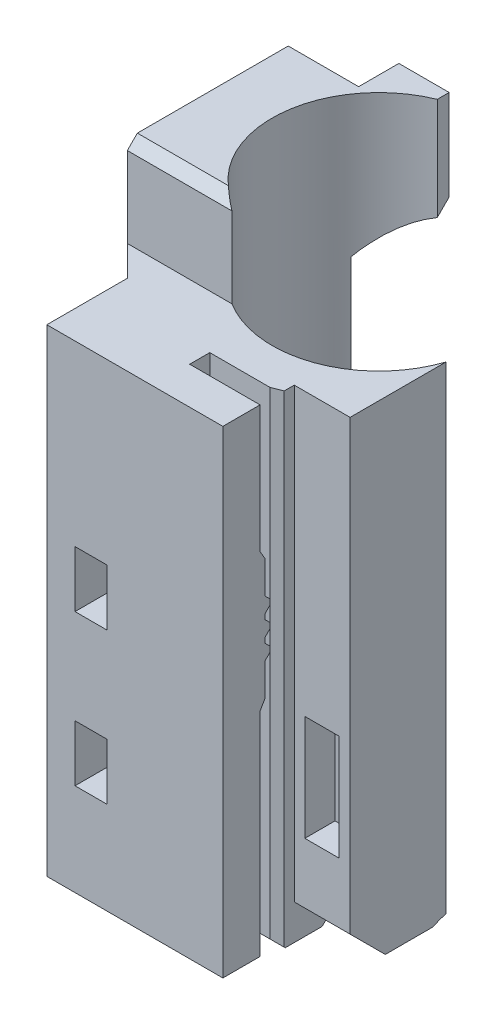
from build123d import *

# Parameters (mm, degrees)
BOSS_EXTRUDE1_DEPTH      = 37
BOSS_EXTRUDE1_DEPTH_BACK = 20
CUT_EXTRUDE5_DEPTH       = 7
CHAMFER2_SIZE            = 3.5
CHAMFER3_SIZE            = 0.5
SKETCH6_R                = 1.55
CUT_EXTRUDE6_DEPTH       = 10
CUT_EXTRUDE7_START       = -2.8
CUT_EXTRUDE7_DEPTH       = 3.2
CUT_EXTRUDE9_DEPTH       = 10
BOSS_EXTRUDE2_DEPTH      = 3
SKETCH10_W               = 7
SKETCH10_H               = 8.2
CUT_EXTRUDE10_DEPTH      = 4
SKETCH11_R               = 1.25
CUT_EXTRUDE11_DEPTH      = 4
CHAMFER4_SIZE            = 3
CUT_EXTRUDE12_DEPTH      = 9
CHAMFER5_SIZE            = 1
SKETCH14_W               = 3.4
SKETCH14_H               = 10.5
CUT_EXTRUDE13_DEPTH      = 3
CHAMFER6_SIZE            = 1
CHAMFER7_SIZE            = 0.4
CHAMFER7_SIZE2           = 1


# Some blends are built 0.0001 mm under size
with BuildPart() as part:
    # Sketch2 → Boss-Extrude1 (new, two sides: drawn at the far end of the back side and taken through both)
    with BuildSketch(Plane(origin=(0, 0, 0), x_dir=(1, 0, 0), z_dir=(0, 1, 0)).offset(-BOSS_EXTRUDE1_DEPTH_BACK)):
        with BuildLine():
            Line((10.05, -12.9), (4.5, -12.9))
            Line((4.5, -12.9), (4.5, -20))
            Line((4.5, -20), (-13, -20))
            Line((-13, -20), (-13, 11))
            Line((-13, 11), (-4, 11))
            Line((-4, 11), (-4, 9.816312953))
            ThreePointArc((-4, 9.816312953), (-7.25402814, -7.729105754), (10.05, -3.37008902))
            Line((10.05, -3.37008902), (10.05, -12.9))
        make_face()
    extrude(amount=BOSS_EXTRUDE1_DEPTH + BOSS_EXTRUDE1_DEPTH_BACK)

    # Sketch5 → Cut-Extrude5 (cut)
    with BuildSketch(Plane(origin=(4.5, 0, 0), x_dir=(0, 0, -1), z_dir=(1, 0, 0))):
        Polygon((-15.8, 5.718), (-15.3, 6.218), (-15.3, 6.718), (-15.8, 7.218), (-15.8, 7.75), (-15.3, 8.25), (-15.3, 8.75), (-15.8, 9.25), (-15.8, 9.782), (-15.3, 10.282), (-15.3, 10.782), (-15.8, 11.282), (-15.8, 14.5), (-16.3, 15.366025404), (-16.3, 37), (-14.3, 37), (-14.3, -20), (-16.3, -20), (-16.3, 1.633974596), (-15.8, 2.5), align=None)
    extrude(amount=-CUT_EXTRUDE5_DEPTH, mode=Mode.SUBTRACT)

    # Chamfer2
    # the kernel refuses this chamfer: 3.5 mm, written as the material it takes off along each edge
    with BuildSketch(Plane(origin=(19.050890458, -20, 12.9), x_dir=(0, 0.9996219169112968, 0.02749587661058662), z_dir=(-1, 0, 0))) as chamfer2_piece_1:
        Polygon((CHAMFER2_SIZE * 0.999621916911, CHAMFER2_SIZE * 0.0274958766106), (-CHAMFER2_SIZE * 0.0274958766106, CHAMFER2_SIZE * 0.999621916911), (0, 0), align=None)
    extrude(amount=14.550890458, mode=Mode.SUBTRACT)

    # Chamfer3
    # the kernel refuses this chamfer: 0.5 mm, written as the material it takes off along each edge
    with BuildSketch(Plane(origin=(-4, -20, -12.285841494), x_dir=(-0.9996219169112968, -0.0274958766105891, 0), z_dir=(0, 0, 1))) as chamfer3_piece_1:
        Polygon((CHAMFER3_SIZE * 0.999621916911, -CHAMFER3_SIZE * 0.0274958766106), (-CHAMFER3_SIZE * 0.0274958766106, -CHAMFER3_SIZE * 0.999621916911), (0, 0), align=None)
    extrude(amount=3.755370035, mode=Mode.SUBTRACT)
    with BuildSketch(Plane(origin=(0, -20, 0), x_dir=(-0.26232896064226713, 0, -0.9649785056716795), z_dir=(0.9649785056716795, 0, -0.26232896064226713))) as chamfer3_piece_2:
        Polygon((10.6 + CHAMFER3_SIZE, 0), (10.6, CHAMFER3_SIZE), (10.6, 0), align=None)
    revolve(axis=Axis((0, -20, 0), (0, 1, 0)), revolution_arc=196.87436844, mode=Mode.SUBTRACT)
    with BuildSketch(Plane(origin=(5.785841494, -20, 14.3), x_dir=(0, -0.0274958766105891, -0.9996219169112968), z_dir=(-1, 0, 0))) as chamfer3_piece_3:
        Polygon((CHAMFER3_SIZE * 0.999621916911, -CHAMFER3_SIZE * 0.0274958766106), (-CHAMFER3_SIZE * 0.0274958766106, -CHAMFER3_SIZE * 0.999621916911), (0, 0), align=None)
    extrude(amount=8.285841494, mode=Mode.SUBTRACT)
    with BuildSketch(Plane(origin=(-2.5, -20, 14.3), x_dir=(-0.9996219169112968, -0.027495876610589075, 0), z_dir=(0, 0, 1))) as chamfer3_piece_4:
        Polygon((CHAMFER3_SIZE * 0.999621916911, -CHAMFER3_SIZE * 0.0274958766106), (-CHAMFER3_SIZE * 0.0274958766106, -CHAMFER3_SIZE * 0.999621916911), (0, 0), align=None)
    extrude(amount=2, mode=Mode.SUBTRACT)
    with BuildSketch(Plane(origin=(5.785841494, -20, 16.3), x_dir=(0, -0.027495876610589005, 0.9996219169112968), z_dir=(-1, 0, 0))) as chamfer3_piece_5:
        Polygon((CHAMFER3_SIZE * 0.999621916911, CHAMFER3_SIZE * 0.0274958766106), (-CHAMFER3_SIZE * 0.0274958766106, CHAMFER3_SIZE * 0.999621916911), (0, 0), align=None)
    extrude(amount=8.285841494, mode=Mode.SUBTRACT)
    with BuildSketch(Plane(origin=(4.5, -20, 15.014158506), x_dir=(-0.9996219169112968, -0.027495876610589075, 0), z_dir=(0, 0, 1))) as chamfer3_piece_6:
        Polygon((CHAMFER3_SIZE * 0.999621916911, -CHAMFER3_SIZE * 0.0274958766106), (-CHAMFER3_SIZE * 0.0274958766106, -CHAMFER3_SIZE * 0.999621916911), (0, 0), align=None)
    extrude(amount=6.271682988, mode=Mode.SUBTRACT)
    with BuildSketch(Plane(origin=(5.785841494, -20, 20), x_dir=(0, -0.027495876610589005, -0.9996219169112968), z_dir=(-1, 0, 0))) as chamfer3_piece_7:
        Polygon((CHAMFER3_SIZE * 0.999621916911, -CHAMFER3_SIZE * 0.0274958766106), (-CHAMFER3_SIZE * 0.0274958766106, -CHAMFER3_SIZE * 0.999621916911), (0, 0), align=None)
    extrude(amount=20.071682988, mode=Mode.SUBTRACT)
    with BuildSketch(Plane(origin=(-13, -20, 21.285841494), x_dir=(0.9996219169112968, -0.0274958766105891, 0), z_dir=(0, 0, -1))) as chamfer3_piece_8:
        Polygon((CHAMFER3_SIZE * 0.999621916911, -CHAMFER3_SIZE * 0.0274958766106), (-CHAMFER3_SIZE * 0.0274958766106, -CHAMFER3_SIZE * 0.999621916911), (0, 0), align=None)
    extrude(amount=33.571682988, mode=Mode.SUBTRACT)
    with BuildSketch(Plane(origin=(-14.285841494, -20, -11), x_dir=(0, -0.0274958766105891, 0.9996219169112968), z_dir=(1, 0, 0))) as chamfer3_piece_9:
        Polygon((CHAMFER3_SIZE * 0.999621916911, -CHAMFER3_SIZE * 0.0274958766106), (-CHAMFER3_SIZE * 0.0274958766106, -CHAMFER3_SIZE * 0.999621916911), (0, 0), align=None)
    extrude(amount=11.571682988, mode=Mode.SUBTRACT)
    with BuildSketch(Plane(origin=(0, -20, 0), x_dir=(0.3514513132600512, 0, 0.9362061602060656), z_dir=(-0.9362061602060656, 0, 0.3514513132600512))) as chamfer3_piece_10:
        Polygon((10.6 + CHAMFER3_SIZE, 0), (10.6, CHAMFER3_SIZE), (10.6, 0), align=None)
    revolve(axis=Axis((0, -20, 0), (0, 1, 0)), revolution_arc=57.836903019, mode=Mode.SUBTRACT)
    with BuildSketch(Plane(origin=(5.785841494, -20, 14.3), x_dir=(0, -0.0274958766105891, -0.9996219169112968), z_dir=(-1, 0, 0))) as chamfer3_piece_11a_section:
        Polygon((CHAMFER3_SIZE * 0.999621916911, -CHAMFER3_SIZE * 0.0274958766106), (-CHAMFER3_SIZE * 0.0274958766106, -CHAMFER3_SIZE * 0.999621916911), (0, 0), align=None)
    chamfer3_piece_11a = extrude(amount=9.571682988, mode=Mode.PRIVATE)
    chamfer3_piece_11a = split(chamfer3_piece_11a, bisect_by=Plane(origin=(-2.5, -19.835103187, 14.135103187), z_dir=(-1, 0, 0)), keep=Keep.TOP, mode=Mode.PRIVATE)
    with BuildSketch(Plane(origin=(-2.5, -20, 13.014158506), x_dir=(-0.9996219169112968, -0.027495876610589075, 0), z_dir=(0, 0, 1))) as chamfer3_piece_11b_section:
        Polygon((CHAMFER3_SIZE * 0.999621916911, -CHAMFER3_SIZE * 0.0274958766106), (-CHAMFER3_SIZE * 0.0274958766106, -CHAMFER3_SIZE * 0.999621916911), (0, 0), align=None)
    chamfer3_piece_11b = extrude(amount=3.285841494, mode=Mode.PRIVATE)
    chamfer3_piece_11b = split(chamfer3_piece_11b, bisect_by=Plane(origin=(-2.664896813, -19.835103187, 14.3), z_dir=(0, 0, -1)), keep=Keep.TOP, mode=Mode.PRIVATE)
    chamfer3_piece_11 = chamfer3_piece_11a & chamfer3_piece_11b
    add(chamfer3_piece_11, mode=Mode.SUBTRACT)
    with BuildSketch(Plane(origin=(-2.5, -20, 14.3), x_dir=(-0.9996219169112968, -0.027495876610589075, 0), z_dir=(0, 0, 1))) as chamfer3_piece_12a_section:
        Polygon((CHAMFER3_SIZE * 0.999621916911, -CHAMFER3_SIZE * 0.0274958766106), (-CHAMFER3_SIZE * 0.0274958766106, -CHAMFER3_SIZE * 0.999621916911), (0, 0), align=None)
    chamfer3_piece_12a = extrude(amount=3.285841494, mode=Mode.PRIVATE)
    chamfer3_piece_12a = split(chamfer3_piece_12a, bisect_by=Plane(origin=(-2.664896813, -19.835103187, 16.3), z_dir=(0, 0, 1)), keep=Keep.TOP, mode=Mode.PRIVATE)
    with BuildSketch(Plane(origin=(5.785841494, -20, 16.3), x_dir=(0, -0.027495876610589005, 0.9996219169112968), z_dir=(-1, 0, 0))) as chamfer3_piece_12b_section:
        Polygon((CHAMFER3_SIZE * 0.999621916911, CHAMFER3_SIZE * 0.0274958766106), (-CHAMFER3_SIZE * 0.0274958766106, CHAMFER3_SIZE * 0.999621916911), (0, 0), align=None)
    chamfer3_piece_12b = extrude(amount=9.571682988, mode=Mode.PRIVATE)
    chamfer3_piece_12b = split(chamfer3_piece_12b, bisect_by=Plane(origin=(-2.5, -19.835103187, 16.464896813), z_dir=(-1, 0, 0)), keep=Keep.TOP, mode=Mode.PRIVATE)
    chamfer3_piece_12 = chamfer3_piece_12a & chamfer3_piece_12b
    add(chamfer3_piece_12, mode=Mode.SUBTRACT)

    # Sketch6 → Cut-Extrude6 (cut)
    with BuildSketch(Plane.ZY.offset(13)):
        with Locations((13, 7.5)):
            Circle(SKETCH6_R)
        with Locations((13, -7.5)):
            Circle(SKETCH6_R)
    extrude(amount=-CUT_EXTRUDE6_DEPTH, mode=Mode.SUBTRACT)

    # Sketch7 → Cut-Extrude7 (cut)
    with BuildSketch(Plane.ZY.offset(13).offset(CUT_EXTRUDE7_START)):
        Polygon((21.967267325, -4.7), (21.967267325, -10.3), (11.383419246, -10.3), (9.766838493, -7.5), (11.383419246, -4.7), align=None)
        Polygon((11.383419246, 4.7), (9.559772236, 7.5), (11.383419246, 10.3), (21.967267325, 10.3), (21.967267325, 4.7), align=None)
    extrude(amount=-CUT_EXTRUDE7_DEPTH, mode=Mode.SUBTRACT)

    # Sketch9 → Cut-Extrude9 (cut)
    with BuildSketch(Plane.ZY.offset(13)):
        Polygon((-11, 28), (-6, 23), (-6, -20), (-11, -20), align=None)
    extrude(amount=-CUT_EXTRUDE9_DEPTH, mode=Mode.SUBTRACT)

    # Sketch12 → Boss-Extrude2 (add)
    with BuildSketch(Plane.ZY.offset(13)):
        Polygon((9, 37), (9, 22.951792944), (-5.951792944, 22.951792944), (-11, 28), (-11, 37), align=None)
    extrude(amount=BOSS_EXTRUDE2_DEPTH)

    # Sketch10 → Cut-Extrude10 (cut)
    with BuildSketch(Plane(origin=(0, 0, -11), x_dir=(-1, 0, 0), z_dir=(0, 0, -1))):
        with Locations((12.5, 32.9)):
            Rectangle(SKETCH10_W, SKETCH10_H)
    extrude(amount=-CUT_EXTRUDE10_DEPTH, mode=Mode.SUBTRACT)

    # Sketch11 → Cut-Extrude11 (cut)
    with BuildSketch(Plane.ZY.offset(16)):
        with Locations((-4, 26.3)):
            Circle(SKETCH11_R)
        with Locations((6, 26.3)):
            Circle(SKETCH11_R)
    extrude(amount=-CUT_EXTRUDE11_DEPTH, mode=Mode.SUBTRACT)

    # Chamfer4
    chamfer4_edges = [part.edges().sort_by_distance(p)[0] for p in [
        (-13, 29.975896472, 9),
        (-13, 22.951792944, 1.524103528),
    ]]
    chamfer(chamfer4_edges, length=CHAMFER4_SIZE - 0.0001)  # a hair under: the kernel refuses the full size

    # Sketch13 → Cut-Extrude12 (cut)
    with BuildSketch(Plane(origin=(0, 37, 0), x_dir=(1, 0, 0), z_dir=(0, 1, 0))):
        Polygon((-16, -9), (0, -9), (0, 6.411173943), (12, 6.411173943), (12, -20), (-16, -20), align=None)
    extrude(amount=-CUT_EXTRUDE12_DEPTH, mode=Mode.SUBTRACT)

    # Chamfer5
    chamfer5_edges = [part.edges().sort_by_distance(p)[0] for p in [
        (-10.8, 37, 9),
    ]]
    chamfer(chamfer5_edges, length=CHAMFER5_SIZE)

    # Sketch14 → Cut-Extrude13 (cut)
    with BuildSketch(Plane.XY.offset(12.9)):
        with Locations((7.25, -5.25)):
            Rectangle(SKETCH14_W, SKETCH14_H)
    extrude(amount=-CUT_EXTRUDE13_DEPTH, mode=Mode.SUBTRACT)

    # Chamfer6
    chamfer6_edges = [part.edges().sort_by_distance(p)[0] for p in [
        (-13, 1.75, -6),
    ]]
    chamfer(chamfer6_edges, length=CHAMFER6_SIZE)

    # Chamfer7
    chamfer7_edges = [part.edges().sort_by_distance(p)[0] for p in [
        (4.5, 4.25, 14.3),
    ]]
    chamfer7_side = [part.faces().sort_by_distance(p)[0] for p in [
        (4.5, 2.170208938, 13.449589105),
    ]]
    chamfer(chamfer7_edges, length=CHAMFER7_SIZE, length2=CHAMFER7_SIZE2, reference=chamfer7_side[0])


solid = part.part
